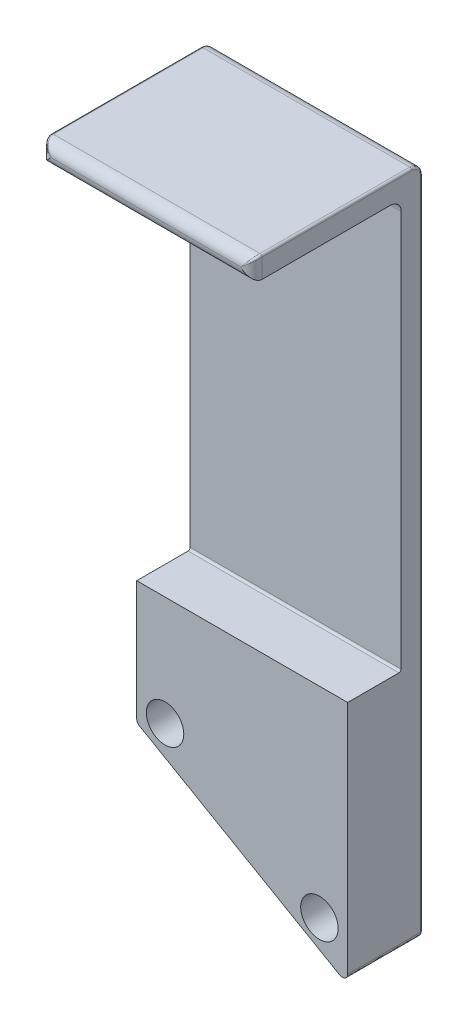
from build123d import *

# Parameters (mm, degrees)
SKETCH1_R           = 1.25
BOSS_EXTRUDE1_DEPTH = 2
BOSS_EXTRUDE2_DEPTH = 16
CUT_EXTRUDE1_START  = 2
SKETCH1_4_R         = 1.75
CUT_EXTRUDE1_DEPTH  = 1.25
FILLET1_R           = 1
FILLET2_R           = 1
BOSS_EXTRUDE3_START = 7
SKETCH1_5_R         = 1.75
BOSS_EXTRUDE3_DEPTH = 7
FILLET5_R           = 0.2


with BuildPart() as part:
    # Sketch1 → Boss-Extrude1 (new body)
    with BuildSketch(Plane.XY):
        with BuildLine():
            Line((138.914825926, 92.111689739), (138.914825926, 33.358171483))
            add(Edge.make_bspline(
                [(138.914825926, 33.358171483), (138.914825926, 32.973308942), (138.498232598, 32.732741629), (138.164899272, 32.925116443)],
                knots=[1, 1, 1, 1, 2, 2, 2, 2], degree=3))
            Line((138.164899272, 32.925116443), (119.44604994, 43.728222166))
            add(Edge.make_bspline(
                [(119.44604994, 43.728222166), (119.29130807, 43.817527483), (119.195976594, 43.982614154), (119.195976594, 44.161277206)],
                knots=[3, 3, 3, 3, 4, 4, 4, 4], degree=3))
            Line((119.195976594, 44.161277206), (119.195976594, 92.109215446))
            Line((119.195976594, 92.109215446), (119.195976594, 95.609149386))
            Line((119.195976594, 95.609149386), (138.914825926, 95.61175586))
            Line((138.914825926, 95.61175586), (138.914825926, 92.111689739))
        make_face()
        with Locations((121.844266769, 45.127233694)):
            Circle(SKETCH1_R, mode=Mode.SUBTRACT)
        with Locations((136.276274547, 36.606306093)):
            Circle(SKETCH1_R, mode=Mode.SUBTRACT)
    extrude(amount=BOSS_EXTRUDE1_DEPTH)

    # Sketch1<3> → Boss-Extrude2 (add)
    with BuildSketch(Plane.XY):
        Polygon((119.195976594, 93.609149368), (138.914825926, 93.611755843), (138.914825926, 95.61175586), (119.195976594, 95.609149386), align=None)
    extrude(amount=BOSS_EXTRUDE2_DEPTH)

    # Sketch1<4> → Cut-Extrude1 (cut)
    with BuildSketch(Plane.XY.offset(CUT_EXTRUDE1_START)):
        with Locations((121.844266769, 45.127233694)):
            Circle(SKETCH1_4_R)
        with Locations((136.276274547, 36.606306093)):
            Circle(SKETCH1_4_R)
    extrude(amount=-CUT_EXTRUDE1_DEPTH, mode=Mode.SUBTRACT)

    # Fillet1
    fillet1_edges = [part.edges().sort_by_distance(p)[0] for p in [
        (129.05540126, 93.610452605, 2),
        (129.05540126, 95.610452623, 0),
    ]]
    fillet(fillet1_edges, radius=FILLET1_R)

    # Fillet2
    fillet2_edges = [part.edges().sort_by_distance(p)[0] for p in [
        (119.195976594, 94.609149377, 16),
        (138.914825926, 94.611755851, 16),
        (129.05540126, 95.610452623, 16),
        (129.05540126, 93.610452605, 16),
    ]]
    fillet(fillet2_edges, radius=FILLET2_R - 0.0001)  # a hair under: the kernel refuses the full size

    # Sketch1<5> → Boss-Extrude3 (add)
    with BuildSketch(Plane.XY.offset(BOSS_EXTRUDE3_START)):
        with BuildLine():
            Line((138.914825926, 33.358171483), (138.914825926, 55.358171483))
            Line((138.914825926, 55.358171483), (119.195976594, 55.358171483))
            Line((119.195976594, 55.358171483), (119.195976594, 44.161277206))
            add(Edge.make_bspline(
                [(119.44604994, 43.728222166), (119.29130807, 43.817527483), (119.195976594, 43.982614154), (119.195976594, 44.161277206)],
                knots=[3, 3, 3, 3, 4, 4, 4, 4], degree=3))
            Line((119.44604994, 43.728222166), (138.164899272, 32.925116443))
            add(Edge.make_bspline(
                [(138.914825926, 33.358171483), (138.914825926, 32.973308942), (138.498232598, 32.732741629), (138.164899272, 32.925116443)],
                knots=[1, 1, 1, 1, 2, 2, 2, 2], degree=3))
        make_face()
        with Locations((121.844266769, 45.127233694)):
            Circle(SKETCH1_5_R, mode=Mode.SUBTRACT)
        with Locations((136.276274547, 36.606306093)):
            Circle(SKETCH1_5_R, mode=Mode.SUBTRACT)
    extrude(amount=-BOSS_EXTRUDE3_DEPTH)

    # Fillet5
    fillet5_edges = [part.edges().sort_by_distance(p)[0] for p in [
        (128.805474606, 38.326669305, 0),
        (138.664862593, 32.925179953, 0),
        (138.914825926, 63.984963667, 0),
        (138.914825926, 95.318862637, 0.292893217),
        (119.195976594, 95.316256163, 0.292893217),
        (138.914825926, 95.61175586, 8.00005),
        (119.195976594, 95.609149386, 8.00005),
        (119.549881202, 95.255291554, 15.763310301),
        (138.560899138, 95.257782286, 15.763329074),
        (119.195976594, 69.385213291, 0),
        (129.05540126, 55.358171483, 2),
        (119.262985066, 43.911240536, 0),
    ]]
    fillet(fillet5_edges, radius=FILLET5_R)


solid = part.part
